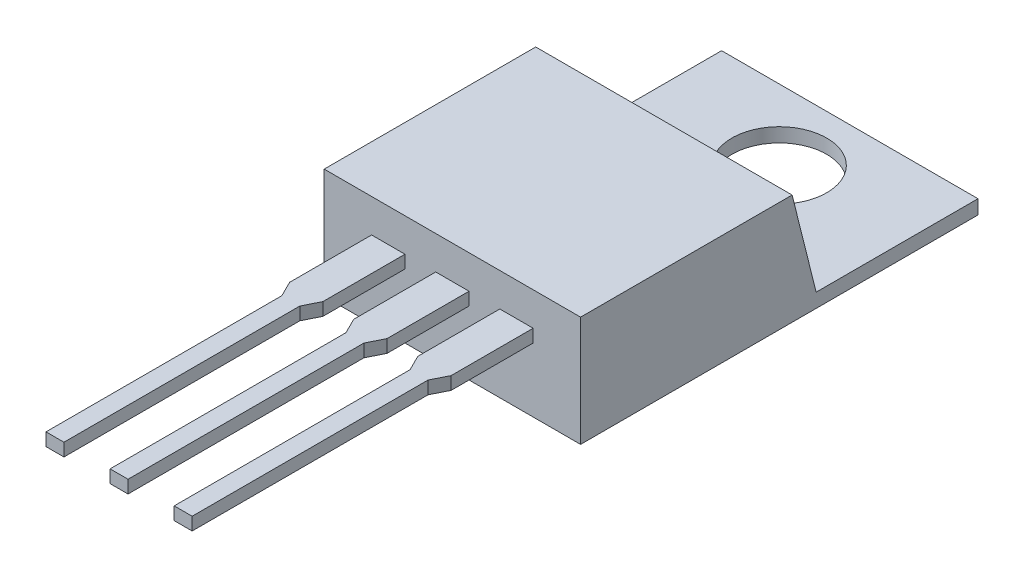
from build123d import *

# Parameters (mm, degrees)
SKETCH1_W           = 10
SKETCH1_H           = 15.5
SKETCH1_R           = 1.85
BOSS_EXTRUDE1_DEPTH = 0.55
SKETCH2_W           = 10
SKETCH2_H           = 9.25
BOSS_EXTRUDE2_DEPTH = 3.75
CHAMFER1_SIZE       = 4
CHAMFER1_SIZE_2     = 1
SKETCH3_W           = 1.3
SKETCH3_H           = 0.5
BOSS_EXTRUDE3_DEPTH = 13
CUT_EXTRUDE1_DEPTH  = 19.688231591


with BuildPart() as part:
    # Sketch1 → Boss-Extrude1 (new body)
    with BuildSketch(Plane(origin=(0, 0, 0), x_dir=(1, 0, 0), z_dir=(0, 1, 0))):
        with Locations((5, 7.75)):
            Rectangle(SKETCH1_W, SKETCH1_H)
        with Locations(Location((5, 12.75, 0), (0, 0, 270))):
            Circle(SKETCH1_R, mode=Mode.SUBTRACT)
    extrude(amount=BOSS_EXTRUDE1_DEPTH)

    # Sketch2 → Boss-Extrude2 (add)
    with BuildSketch(Plane(origin=(0, 0.55, 0), x_dir=(1, 0, 0), z_dir=(0, 1, 0))):
        with Locations((5, 4.625)):
            Rectangle(SKETCH2_W, SKETCH2_H)
    extrude(amount=BOSS_EXTRUDE2_DEPTH)

    # Chamfer1
    # the kernel refuses this chamfer: 4, 1 mm, written as the material it takes off along each edge
    with BuildSketch(Plane(origin=(20.388509999, 4.3, -9.25), x_dir=(0, -0.9999563942249224, -0.00933861064031752), z_dir=(-1, 0, 0))) as chamfer1_piece_1_section:
        Polygon((CHAMFER1_SIZE * 0.999956394225, CHAMFER1_SIZE * 0.00933861064032), (-CHAMFER1_SIZE_2 * 0.00933861064032, CHAMFER1_SIZE_2 * 0.999956394225), (0, 0), align=None)
    chamfer1_piece_1 = extrude(amount=30.777019998, mode=Mode.PRIVATE)
    chamfer1_piece_1 = split(chamfer1_piece_1, bisect_by=Plane(origin=(5, 0.55, -8.951597726), z_dir=(0, 1, 0)), keep=Keep.TOP, mode=Mode.PRIVATE)
    add(chamfer1_piece_1, mode=Mode.SUBTRACT)

    # Sketch3 → Boss-Extrude3 (add)
    with BuildSketch(Plane.XY):
        with Locations((2.5, 2.75)):
            Rectangle(SKETCH3_W, SKETCH3_H)
        with Locations((5, 2.75)):
            Rectangle(SKETCH3_W, SKETCH3_H)
        with Locations((7.5, 2.75)):
            Rectangle(SKETCH3_W, SKETCH3_H)
    extrude(amount=BOSS_EXTRUDE3_DEPTH)

    # Sketch4 → Cut-Extrude1 (cut, through all)
    with BuildSketch(Plane(origin=(0, 3, 0), x_dir=(1, 0, 0), z_dir=(0, 1, 0))):
        Polygon((1.85, -3.2), (2.15, -3.8), (2.15, -13), (1.85, -13), align=None)
        Polygon((4.35, -3.2), (4.65, -3.8), (4.65, -13), (4.35, -13), align=None)
        Polygon((6.85, -3.2), (7.15, -3.8), (7.15, -13), (6.85, -13), align=None)
        Polygon((3.15, -3.2), (2.85, -3.8), (2.85, -13), (3.15, -13), align=None)
        Polygon((5.65, -3.2), (5.35, -3.8), (5.35, -13), (5.65, -13), align=None)
        Polygon((8.15, -3.2), (7.85, -3.8), (7.85, -13), (8.15, -13), align=None)
    extrude(amount=-CUT_EXTRUDE1_DEPTH, mode=Mode.SUBTRACT)


solid = part.part
